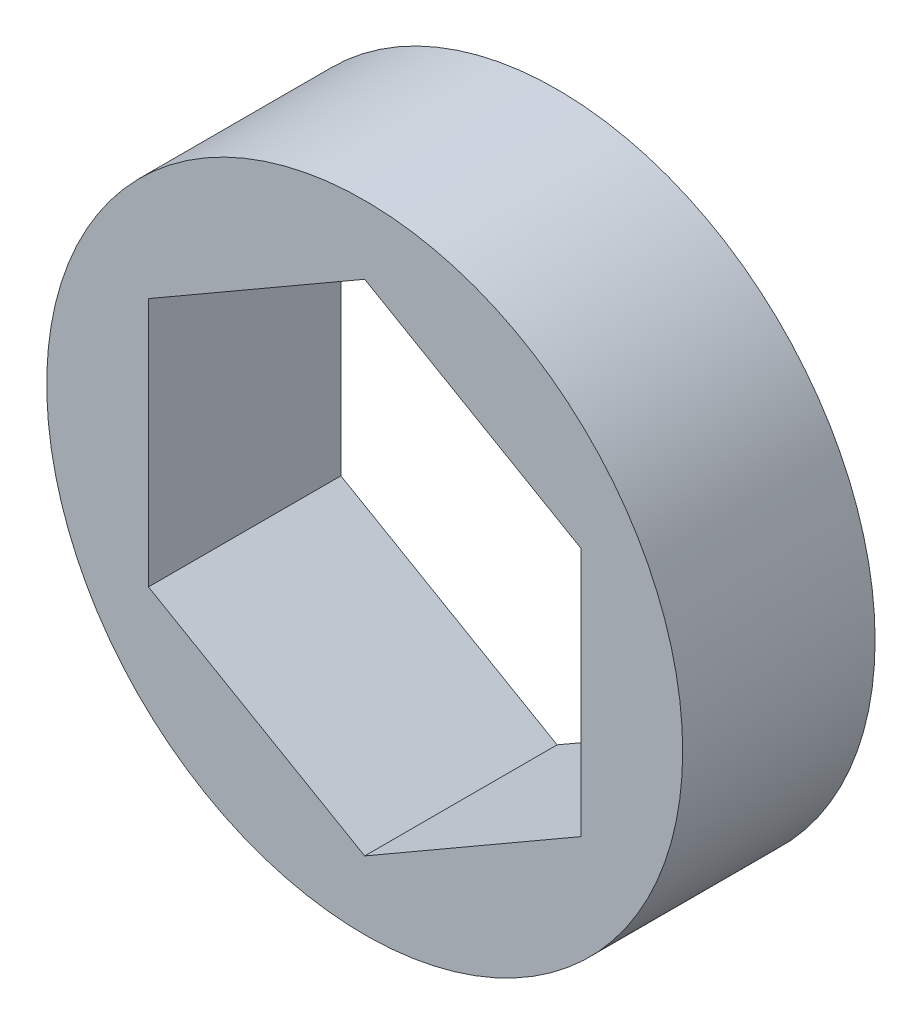
from build123d import *

# Parameters (mm, degrees)
SKETCH1_R           = 9.525
BOSS_EXTRUDE1_DEPTH = 2.88163


with BuildPart() as part:
    # Sketch1 → Boss-Extrude1 (new, symmetric)
    with BuildSketch(Plane.XY):
        Circle(SKETCH1_R)
        Polygon((0, 7.478995387), (-6.477, 3.739497694), (-6.477, -3.739497694), (0, -7.478995387), (6.477, -3.739497694), (6.477, 3.739497694), align=None, mode=Mode.SUBTRACT)
    extrude(amount=BOSS_EXTRUDE1_DEPTH, both=True)


solid = part.part
